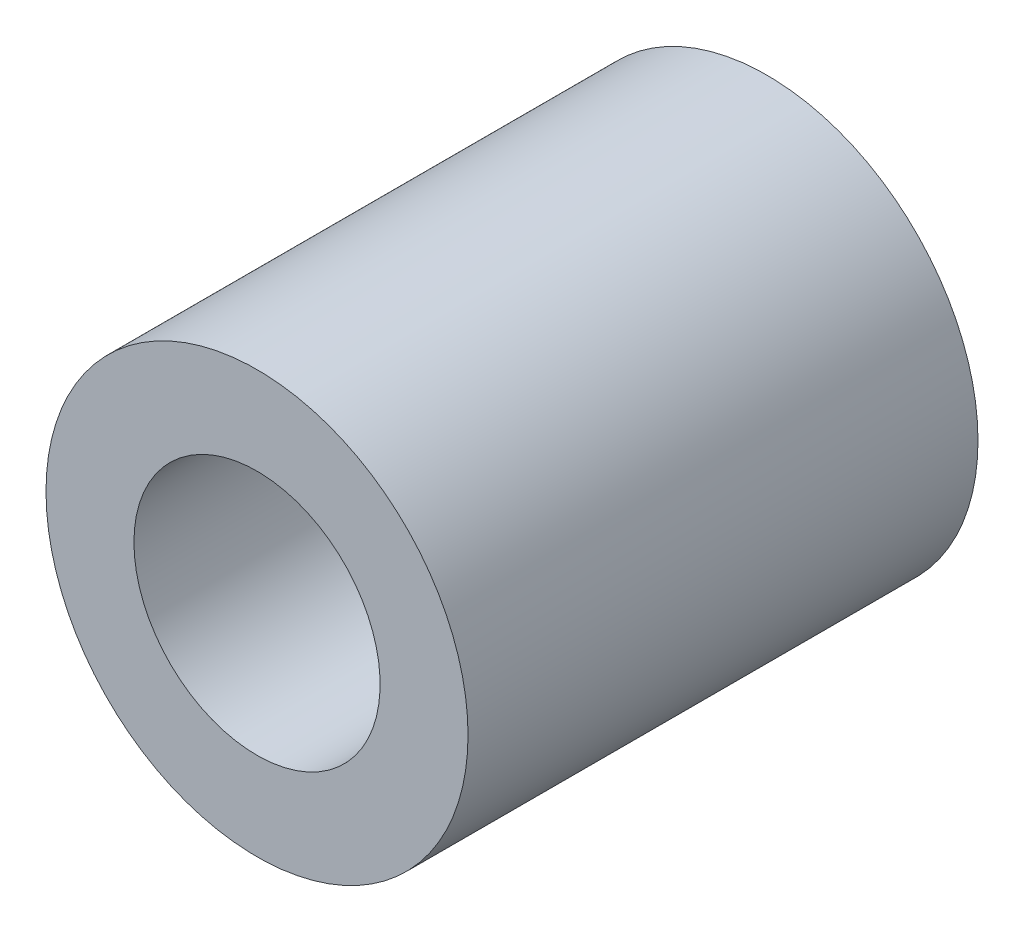
from build123d import *

# Parameters (mm, degrees)
SKETCH_1_R      = 6
SKETCH_1_R_2    = 3.5
EXTRUDE_1_DEPTH = 14.5


with BuildPart() as part:
    # 草图1 → 凸台-拉伸1 (new body)
    with BuildSketch(Plane.XY):
        Circle(SKETCH_1_R)
        Circle(SKETCH_1_R_2, mode=Mode.SUBTRACT)
    extrude(amount=EXTRUDE_1_DEPTH)


solid = part.part
